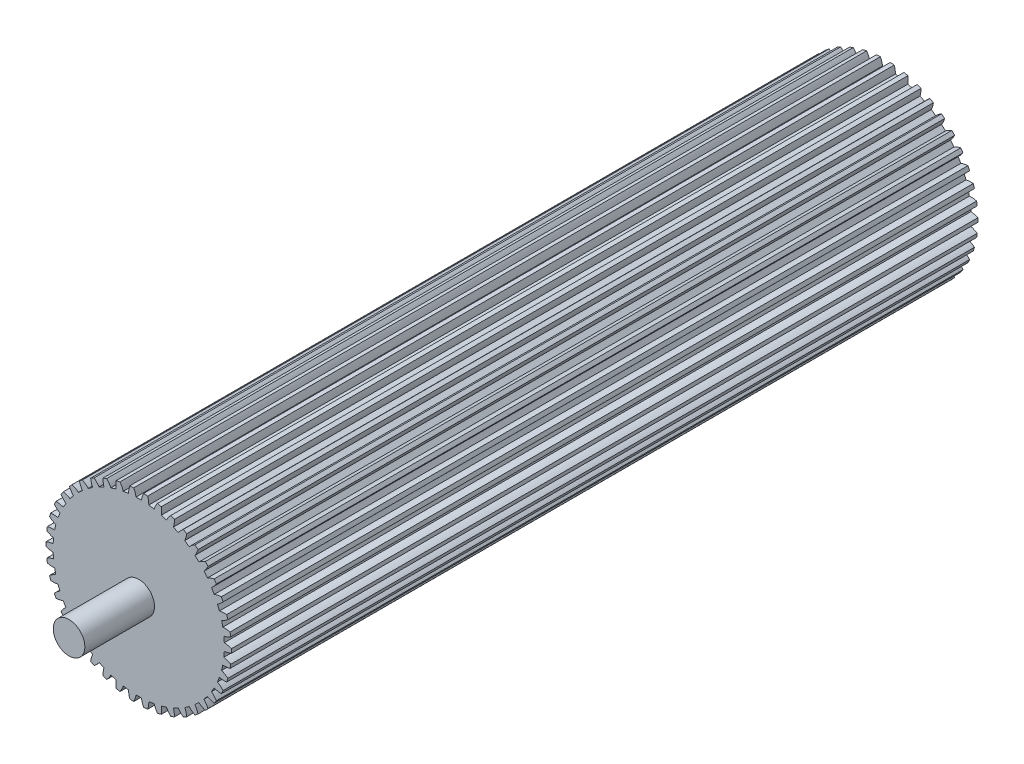
from build123d import *

# Parameters (mm, degrees)
SKETCH1_R           = 18.626666667
BOSS_EXTRUDE1_DEPTH = 150
CUT_EXTRUDE2_DEPTH  = 151
CIRPATTERN1_COUNT   = 42
SKETCH3_R           = 3.175
BOSS_EXTRUDE2_DEPTH = 8
BOSS_EXTRUDE3_START = 164
SKETCH4_R           = 3.175
BOSS_EXTRUDE3_DEPTH = 14


with BuildPart() as part:
    # Sketch1 → Boss-Extrude1 (new body)
    with BuildSketch(Plane.XY):
        Circle(SKETCH1_R)
    extrude(amount=BOSS_EXTRUDE1_DEPTH)

    # Sketch2 → Cut-Extrude2 (cut, symmetric)
    with BuildSketch(Plane.XY):
        with BuildLine():
            add(Edge.make_bspline(
                [(17.197794317, 0.739009432), (17.203892696, 0.739218074), (17.21543595, 0.73930356), (17.234290481, 0.73910886), (17.271535049, 0.737867759), (17.313692039, 0.735293434), (17.361379443, 0.731228124), (17.412709302, 0.725698856), (17.45664549, 0.720250412), (17.500520881, 0.714143297), (17.54427023, 0.70745302), (17.597315869, 0.698630803), (17.66099398, 0.687053386), (17.735530693, 0.672062459), (17.820194333, 0.653336786), (17.906624473, 0.632403089), (17.991790805, 0.610283496), (18.077983339, 0.586179627), (18.161481204, 0.561614407), (18.248366585, 0.534292881), (18.328644137, 0.508156476), (18.418766174, 0.476867684), (18.491547283, 0.451032541), (18.566887923, 0.422665763), (18.603580461, 0.408611376), (18.622342766, 0.401324063)],
                knots=[0, 0, 0, 0, 0, 0.015083688, 0.02853182, 0.04661014, 0.092110526, 0.119476176, 0.146842496, 0.174208854, 0.201574956, 0.228941013, 0.256307345, 0.307035032, 0.361767352, 0.416499661, 0.471231937, 0.525964282, 0.580696616, 0.635428982, 0.690161387, 0.744893688, 0.799626082, 0.854358407, 0.909090914, 0.909090914, 0.909090914, 0.909090914, 0.909090914], degree=4))
            Line((18.622342766, 0.401324063), (59.986071903, 1.29274036))
            add(Edge.make_bspline(
                [(59.986071903, 1.29274036), (59.984705998, 1.356121459), (59.981788512, 1.47956213), (59.973929675, 1.790524821), (59.96571531, 2.028377944), (59.95367575, 2.372260269), (59.94146295, 2.652288961), (59.926888549, 2.970752343), (59.911256555, 3.265919581), (59.893811207, 3.574911958), (59.874955933, 3.875648951), (59.85453816, 4.180793709), (59.83250074, 4.483826067), (59.809127391, 4.786758311), (59.783837648, 5.091537965), (59.757659801, 5.391726207), (59.728857375, 5.699867489), (59.700322379, 5.99406778), (59.667269491, 6.311146391), (59.637609774, 6.589867618), (59.598261861, 6.931703464), (59.570934309, 7.168124252), (59.532358786, 7.476785046), (59.516845808, 7.599281815), (59.508749995, 7.662158578)],
                knots=[0.083333333, 0.083333333, 0.083333333, 0.083333333, 0.083333333, 0.123015873, 0.162698413, 0.202380952, 0.242063492, 0.281746032, 0.321428571, 0.361111111, 0.400793651, 0.44047619, 0.48015873, 0.51984127, 0.55952381, 0.599206349, 0.638888889, 0.678571429, 0.718253968, 0.757936508, 0.797619048, 0.837301587, 0.876984127, 0.916666667, 0.916666667, 0.916666667, 0.916666667, 0.916666667], degree=4))
            Line((59.508749995, 7.662158578), (18.474160832, 2.378674563))
            add(Edge.make_bspline(
                [(17.115852804, 1.832442931), (17.121914166, 1.833145535), (17.133341232, 1.834781437), (17.151956155, 1.837784085), (17.188599755, 1.844562338), (17.229902204, 1.853391084), (17.276451075, 1.864518426), (17.326383528, 1.877636255), (17.369016937, 1.889572194), (17.411492058, 1.902150385), (17.453755628, 1.915286439), (17.504893908, 1.931916162), (17.566135263, 1.952854998), (17.63760518, 1.978787609), (17.718532281, 2.009922593), (17.800877062, 2.043504222), (17.881795402, 2.07807014), (17.963432742, 2.11475112), (18.042336749, 2.151486678), (18.124179629, 2.191452639), (18.199665119, 2.22926187), (18.284117214, 2.273633185), (18.35223489, 2.310027232), (18.422506189, 2.349306116), (18.456694203, 2.368672266), (18.474160832, 2.378674563)],
                knots=[0, 0, 0, 0, 0, 0.015083688, 0.02853182, 0.04661014, 0.092110526, 0.119476176, 0.146842496, 0.174208854, 0.201574956, 0.228941013, 0.256307345, 0.307035032, 0.361767352, 0.416499661, 0.471231937, 0.525964282, 0.580696616, 0.635428982, 0.690161387, 0.744893688, 0.799626082, 0.854358407, 0.909090914, 0.909090914, 0.909090914, 0.909090914, 0.909090914], degree=4))
            Line((17.115852804, 1.832442931), (17.197794317, 0.739009432))
        make_face()
    cut_extrude2 = extrude(amount=CUT_EXTRUDE2_DEPTH, both=True, mode=Mode.SUBTRACT)

    # CirPattern1: Cut-Extrude2 ×42 about axis
    cirpattern1_axis = Axis((0, 0, -16.6), (0, 0, 1))
    for i in range(1, CIRPATTERN1_COUNT):
        add(cut_extrude2.rotate(cirpattern1_axis, i * 360 / CIRPATTERN1_COUNT), mode=Mode.SUBTRACT)

    # Sketch3 → Boss-Extrude2 (add)
    with BuildSketch(Plane.XY):
        Circle(SKETCH3_R)
    extrude(amount=-BOSS_EXTRUDE2_DEPTH)

    # Sketch4 → Boss-Extrude3 (add)
    with BuildSketch(Plane.XY.offset(BOSS_EXTRUDE3_START)):
        Circle(SKETCH4_R)
    extrude(amount=-BOSS_EXTRUDE3_DEPTH)


solid = part.part
